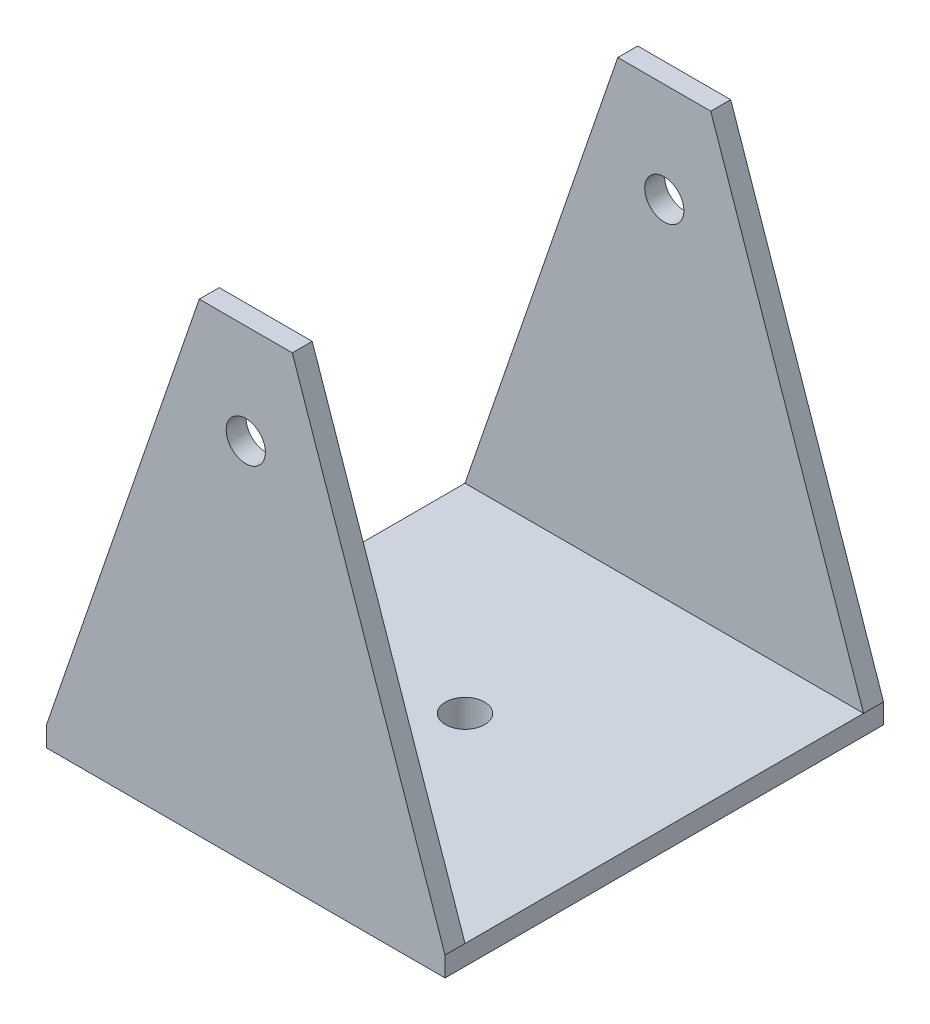
from build123d import *

# Parameters (mm, degrees)
SKETCH1_W           = 60
SKETCH1_H           = 60
SKETCH1_R           = 2.95
BOSS_EXTRUDE1_DEPTH = 3
BOSS_EXTRUDE2_START = 2
SKETCH2_R           = 4.5
SKETCH2_R_2         = 2.95
BOSS_EXTRUDE2_DEPTH = 2
BOSS_EXTRUDE3_DEPTH = 3
SKETCH5_R           = 2.95
CUT_EXTRUDE1_DEPTH  = 3


with BuildPart() as part:
    # Sketch1 → Boss-Extrude1 (new body)
    with BuildSketch(Plane(origin=(0, 0, 0), x_dir=(1, 0, 0), z_dir=(0, 1, 0))):
        Rectangle(SKETCH1_W, SKETCH1_H)
        Circle(SKETCH1_R, mode=Mode.SUBTRACT)
    boss_extrude1 = extrude(amount=BOSS_EXTRUDE1_DEPTH)

    # Sketch2 → Boss-Extrude2 (add)
    with BuildSketch(Plane.XZ.offset(BOSS_EXTRUDE2_START)):
        Circle(SKETCH2_R)
        Circle(SKETCH2_R_2, mode=Mode.SUBTRACT)
    extrude(amount=-BOSS_EXTRUDE2_DEPTH)

    # Sketch4 → Boss-Extrude3 (add)
    with BuildSketch(Plane(origin=(0, 0, -30), x_dir=(-1, 0, 0), z_dir=(0, 0, -1))):
        Polygon((-30, 3), (-30, 0), (30, 0), (30, 3), (7, 70), (-7, 70), align=None)
    boss_extrude3 = extrude(amount=BOSS_EXTRUDE3_DEPTH)

    # Sketch5 → Cut-Extrude1 (cut)
    with BuildSketch(Plane(origin=(0, 0, -33), x_dir=(-1, 0, 0), z_dir=(0, 0, -1))):
        with Locations((0, 55)):
            Circle(SKETCH5_R)
    cut_extrude1 = extrude(amount=-CUT_EXTRUDE1_DEPTH, mode=Mode.SUBTRACT)

    # Mirror2: Boss-Extrude1, Boss-Extrude3, Cut-Extrude1 across plane
    add(boss_extrude1.mirror(Plane.XY))
    add(boss_extrude3.mirror(Plane.XY))
    add(cut_extrude1.mirror(Plane.XY), mode=Mode.SUBTRACT)


solid = part.part
